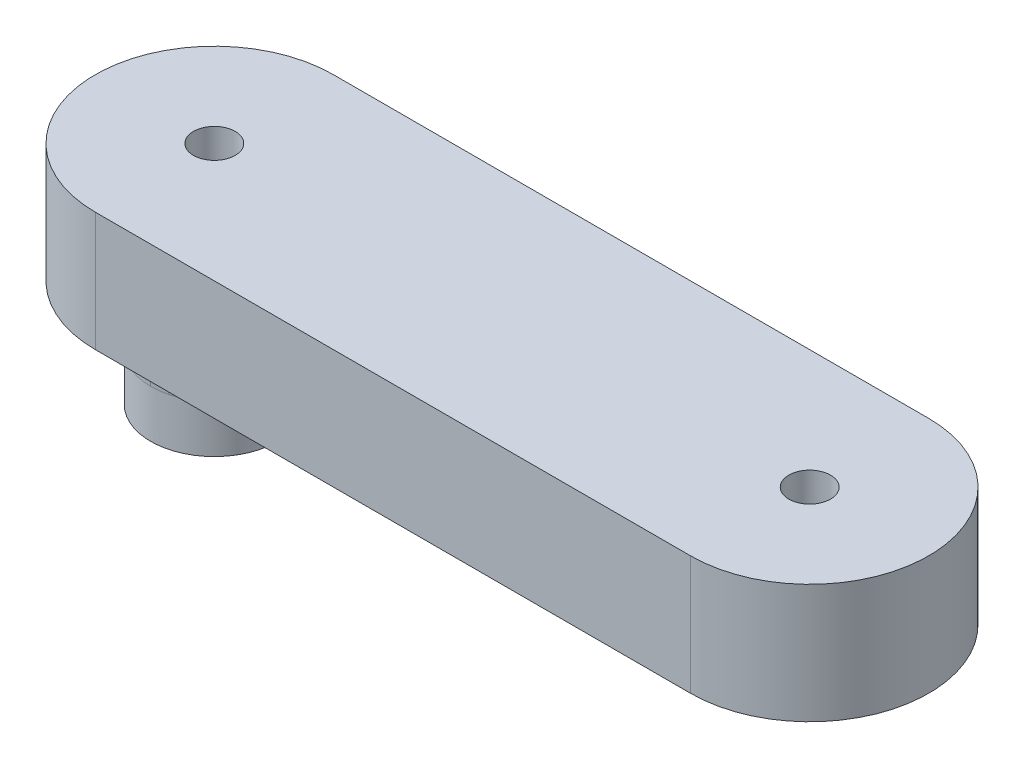
from build123d import *

# Parameters (mm, degrees)
BOSS_EXTRUDE1_DEPTH = 10
CUT_EXTRUDE1_REACH  = 39.749
SKETCH2_R           = 1.75
SKETCH5_R           = 5.35
BOSS_EXTRUDE3_DEPTH = 9
FILLET1_R           = 5
CUT_EXTRUDE2_REACH  = 43.061
SKETCH6_R           = 1.75


with BuildPart() as part:
    # Sketch1 → Boss-Extrude1 (new body)
    with BuildSketch(Plane(origin=(0, 0, 0), x_dir=(1, 0, 0), z_dir=(0, 1, 0))):
        with BuildLine():
            Line((-25, 10), (25, 10))
            ThreePointArc((25, 10), (35, 0), (25, -10))
            Line((25, -10), (-25, -10))
            ThreePointArc((-25, -10), (-35, 0), (-25, 10))
        make_face()
    extrude(amount=BOSS_EXTRUDE1_DEPTH)

    # Sketch2 → Cut-Extrude1 (cut, up to next)
    with BuildSketch(Plane(origin=(0, 10, 0), x_dir=(1, 0, 0), z_dir=(0, 1, 0)), mode=Mode.PRIVATE) as cut_extrude1_sk1:
        with Locations((25, 0)):
            Circle(SKETCH2_R)
    cut_extrude1_tool1 = extrude(cut_extrude1_sk1.sketch, amount=-CUT_EXTRUDE1_REACH, mode=Mode.PRIVATE) & part.part
    add(cut_extrude1_tool1.solids().sort_by_distance((25, 10, 0))[0], mode=Mode.SUBTRACT)

    # Sketch5 → Boss-Extrude3 (add)
    with BuildSketch(Plane.XZ):
        with Locations((-25, 0)):
            Circle(SKETCH5_R)
    extrude(amount=BOSS_EXTRUDE3_DEPTH)

    # Fillet1
    fillet1_edges = [part.edges().sort_by_distance(p)[0] for p in [
        (-30.35, 0, 0),
    ]]
    fillet(fillet1_edges, radius=FILLET1_R)

    # Sketch6 → Cut-Extrude2 (cut, up to next)
    with BuildSketch(Plane(origin=(0, -9, 0), x_dir=(-1, 0, 0), z_dir=(0, -1, 0)), mode=Mode.PRIVATE) as cut_extrude2_sk1:
        with Locations((25, 0)):
            Circle(SKETCH6_R)
    cut_extrude2_tool1 = extrude(cut_extrude2_sk1.sketch, amount=-CUT_EXTRUDE2_REACH, mode=Mode.PRIVATE) & part.part
    add(cut_extrude2_tool1.solids().sort_by_distance((-25, -9, 0))[0], mode=Mode.SUBTRACT)


solid = part.part
